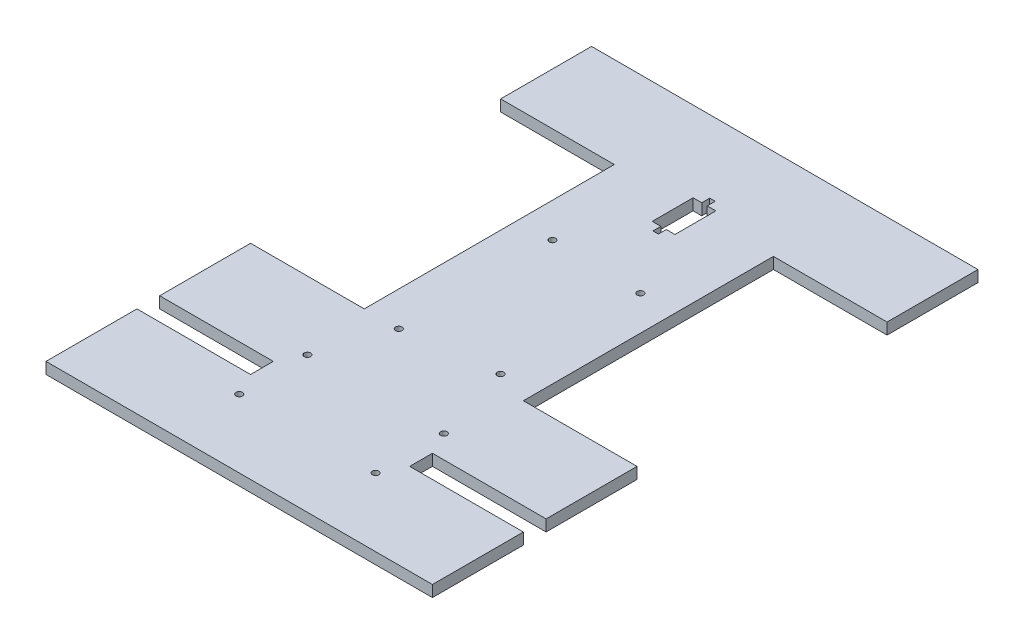
from build123d import *

# Parameters (mm, degrees)
BOSS_EXTRUDE1_DEPTH = 6.35
SKETCH2_R           = 1.80975
CUT_EXTRUDE1_DEPTH  = 187.867024913


with BuildPart() as part:
    # Sketch1 → Boss-Extrude1 (new body)
    with BuildSketch(Plane(origin=(0, 0, 0), x_dir=(1, 0, 0), z_dir=(0, 1, 0))):
        Polygon((-107.95, 152.4), (-107.95, 101.6), (-44.45, 101.6), (-44.45, -38.1), (-107.95, -38.1), (-107.95, -88.9), (-44.45, -88.9), (-44.45, -101.6), (-107.95, -101.6), (-107.95, -152.4), (107.95, -152.4), (107.95, -101.6), (44.45, -101.6), (44.45, -88.9), (107.95, -88.9), (107.95, -38.1), (44.45, -38.1), (44.45, 101.6), (107.95, 101.6), (107.95, 152.4), align=None)
    extrude(amount=BOSS_EXTRUDE1_DEPTH)

    # Sketch2 → Cut-Extrude1 (cut, through all)
    with BuildSketch(Plane(origin=(0, 6.35, 0), x_dir=(1, 0, 0), z_dir=(0, 1, 0))):
        Polygon((-6.35, 107.54614), (-6.35, 84.68614), (-1.524, 84.68614), (-1.524, 80.24114), (1.524, 80.24114), (1.524, 84.68614), (6.35, 84.68614), (6.35, 107.54614), (1.524, 107.54614), (1.524, 111.99114), (-1.524, 111.99114), (-1.524, 107.54614), align=None)
        with Locations((-38.1, -76.2)):
            Circle(SKETCH2_R)
        with Locations((38.1, -76.2)):
            Circle(SKETCH2_R)
        with Locations((-38.1, -114.3)):
            Circle(SKETCH2_R)
        with Locations((38.1, -114.3)):
            Circle(SKETCH2_R)
        with Locations((-25.14473, 47.72914)):
            Circle(SKETCH2_R)
        with Locations((25.14473, 46.58614)):
            Circle(SKETCH2_R)
        with Locations((25.14473, -31.56966)):
            Circle(SKETCH2_R)
        with Locations((-25.14473, -38.1)):
            Circle(SKETCH2_R)
    extrude(amount=-CUT_EXTRUDE1_DEPTH, mode=Mode.SUBTRACT)


solid = part.part
